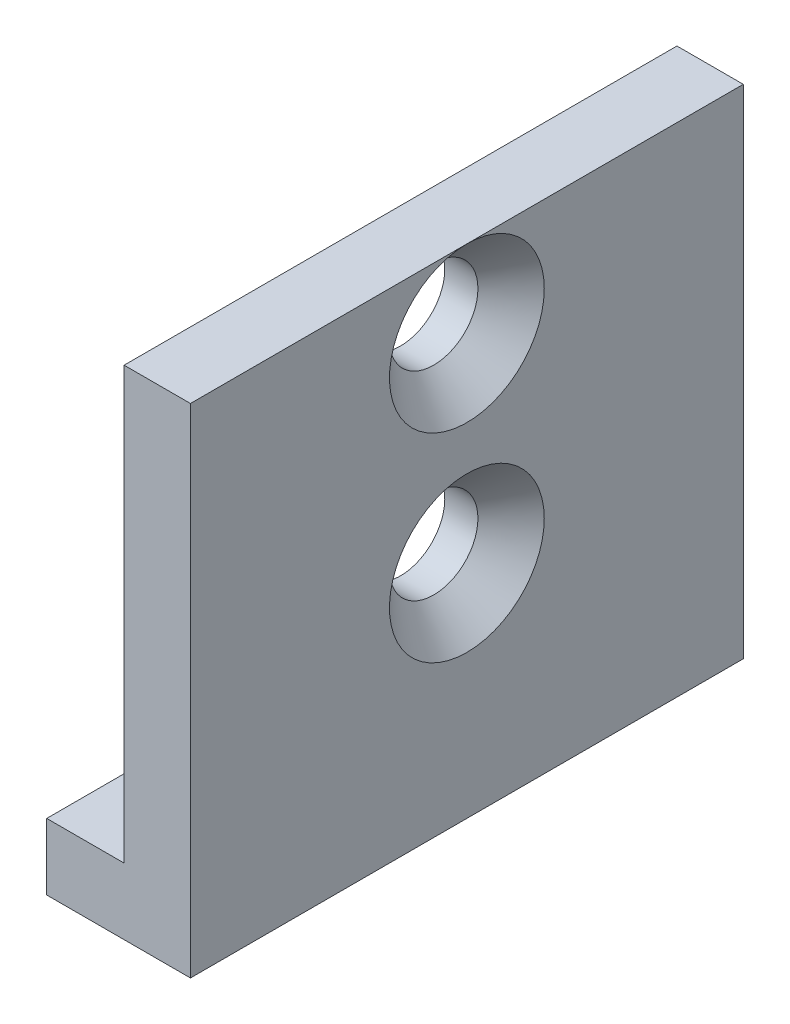
from build123d import *

# Parameters (mm, degrees)
BOSS_EXTRUDE1_DEPTH   = 25
F_1_0MM_DOWEL_HOLE1_D = 8
CHAMFER1_SIZE         = 3


with BuildPart() as part:
    # Sketch1 → Boss-Extrude1 (new, symmetric)
    with BuildSketch(Plane.XY):
        Polygon((-59.365603585, 18.386149477), (-59.365603585, 63.386149477), (-65.365603585, 63.386149477), (-65.365603585, 24.386149477), (-72.365603585, 24.386149477), (-72.365603585, 18.386149477), align=None)
    extrude(amount=BOSS_EXTRUDE1_DEPTH, both=True)

    # Ø1.0mm Dowel Hole1 (through all)
    with Locations(Plane(origin=(-59.365603585, 0, 0), x_dir=(0, 0, -1), z_dir=(1, 0, 0))):
        with Locations((0, 56.386149477), (0, 38.386149477)):
            Hole(F_1_0MM_DOWEL_HOLE1_D / 2)

    # Chamfer1
    chamfer1_edges = [part.edges().sort_by_distance(p)[0] for p in [
        (-59.365603585, 38.386149477, -4),
        (-59.365603585, 56.386149477, -4),
    ]]
    chamfer(chamfer1_edges, length=CHAMFER1_SIZE - 0.0001)  # a hair under: the kernel refuses the full size


solid = part.part
